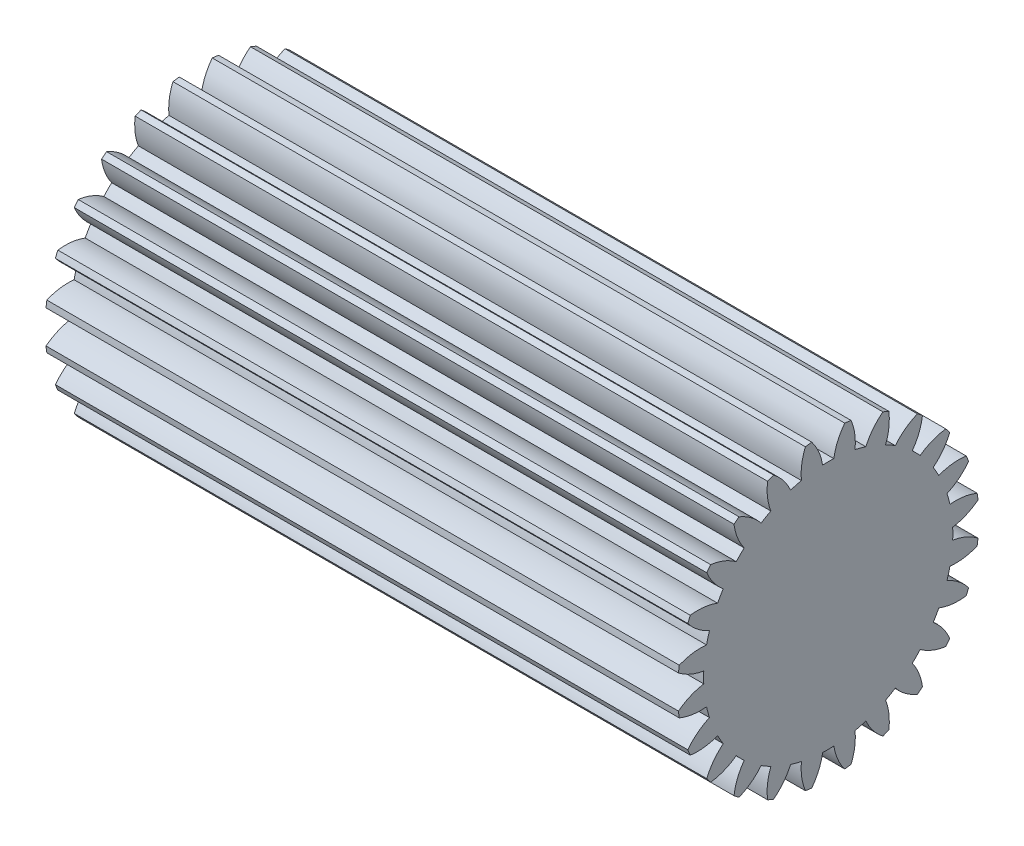
from build123d import *

# Parameters (mm, degrees)
BASPROSKE_W     = 54.565
BASPROSKE_H     = 13
TOOTHCUT_DEPTH  = 58.578982494
TEETHCUTS_COUNT = 24
TEETHCUTS_ANGLE = 345
BORSKE_R        = 0.4
BORE_DEPTH      = 50.0000508
SCALE1_SCALE    = 2
SCALE2_SCALE    = 0.666666667


with BuildPart() as part:
    # BasProSke → Base-Revolve (revolve)
    with BuildSketch(Plane(origin=(0, 0, 0), x_dir=(1, 0, 0), z_dir=(0, 1, 0))):
        with Locations((27.2825, 6.5)):
            Rectangle(BASPROSKE_W, BASPROSKE_H)
    revolve(axis=Axis((-10, 0, 0), (1, 0, 0)))

    # TooCutSke → ToothCut (cut, through all)
    with BuildSketch(Plane(origin=(0, 0, 0), x_dir=(0, 0, -1), z_dir=(1, 0, 0))):
        with BuildLine():
            ThreePointArc((0.483448384, 10.738122679), (0, 10.749), (-0.483448384, 10.738122679))
            ThreePointArc((-0.483448384, 10.738122679), (-0.821636462, 11.902754369), (-1.44092227, 12.945454344))
            ThreePointArc((-1.44092227, 12.945454344), (0, 13.0254), (1.44092227, 12.945454344))
            ThreePointArc((1.44092227, 12.945454344), (0.821636462, 11.902754369), (0.483448384, 10.738122679))
        make_face()
    toothcut = extrude(amount=TOOTHCUT_DEPTH, mode=Mode.SUBTRACT)

    # TeethCuts: ToothCut ×24 about axis
    teethcuts_axis = Axis((-10, 0, 0), (1, 0, 0))
    for i in range(1, TEETHCUTS_COUNT):
        add(toothcut.rotate(teethcuts_axis, i * TEETHCUTS_ANGLE / (TEETHCUTS_COUNT - 1)), mode=Mode.SUBTRACT)

    # BorSke → Bore (cut, symmetric)
    with BuildSketch(Plane(origin=(0, 0, 0), x_dir=(0, 0, -1), z_dir=(1, 0, 0))):
        Circle(BORSKE_R)
    extrude(amount=BORE_DEPTH, both=True, mode=Mode.SUBTRACT)


with BuildPart() as part_1:
    # Scale1: scaled about (27.284897052, 0, 0)
    add(part.part.scale(SCALE1_SCALE).moved(Location((-27.284897052, 0, 0))))


with BuildPart() as part_2:
    # Scale2: scaled about (27.284897052, 0, 0)
    add(part_1.part.scale(SCALE2_SCALE).moved(Location((9.094965684, 0, 0))))


solid = part_2.part
